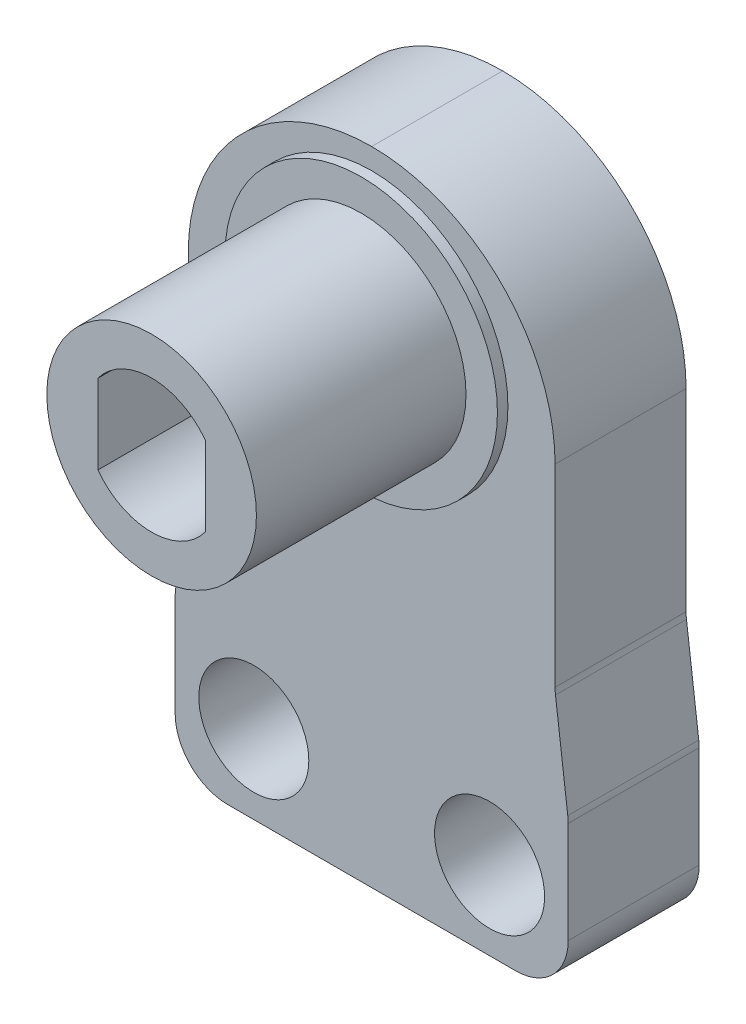
from build123d import *

# Parameters (mm, degrees)
SKETCH2_W           = 71.4
SKETCH2_H           = 93
SKETCH2_W_2         = 51.4
SKETCH2_H_2         = 73
BOSS_EXTRUDE1_DEPTH = 10
SKETCH3_W           = 14
SKETCH3_H           = 26
SKETCH3_R           = 2.75
BOSS_EXTRUDE2_DEPTH = 5
SKETCH4_R           = 4
SKETCH4_R_2         = 2.75
BOSS_EXTRUDE3_DEPTH = 8.4
SKETCH5_W           = 51.4
SKETCH5_H           = 10
CUT_EXTRUDE1_DEPTH  = 65.130647899
SKETCH6_R           = 5.2
SKETCH6_R_2         = 4
BOSS_EXTRUDE4_DEPTH = 0.4
SKETCH7_W           = 71.4
SKETCH7_H           = 25
CUT_EXTRUDE2_DEPTH  = 65.130647899
FILLET1_START       = -46.5
FILLET1_DEPTH       = 5
FILLET1_2_DEPTH     = 5
SKETCH10_W          = 71.4
SKETCH10_H          = 58
CUT_EXTRUDE3_DEPTH  = 65.130647899
SKETCH9_R           = 2.55
CUT_EXTRUDE4_DEPTH  = 53.440919138
FILLET2_R           = 5
SKETCH11_R          = 2.75
BOSS_EXTRUDE5_DEPTH = 13.4
CHAMFER1_SIZE       = 0.5
CUT_EXTRUDE5_DEPTH  = 52.676783956
SKETCH14_R          = 2.1
BOSS_EXTRUDE6_DEPTH = 5
FILLET3_R           = 2


with BuildPart() as part:
    # Sketch2 → Boss-Extrude1 (new body)
    with BuildSketch(Plane(origin=(0, 0, 0), x_dir=(1, 0, 0), z_dir=(0, 1, 0))):
        Rectangle(SKETCH2_W, SKETCH2_H)
        Rectangle(SKETCH2_W_2, SKETCH2_H_2, mode=Mode.SUBTRACT)
    extrude(amount=BOSS_EXTRUDE1_DEPTH)

    # Sketch3 → Boss-Extrude2 (add)
    with BuildSketch(Plane(origin=(0, 0, -46.5), x_dir=(-1, 0, 0), z_dir=(0, 0, -1))):
        with Locations((0, 23)):
            Rectangle(SKETCH3_W, SKETCH3_H)
        with Locations((0, 30)):
            Circle(SKETCH3_R, mode=Mode.SUBTRACT)
    extrude(amount=-BOSS_EXTRUDE2_DEPTH)

    # Sketch4 → Boss-Extrude3 (add)
    with BuildSketch(Plane.XY.offset(-41.5)):
        with Locations(Location((0, 30, 0), (0, 0, 180))):
            Circle(SKETCH4_R)
        with Locations(Location((0, 30, 0), (0, 0, 180))):
            Circle(SKETCH4_R_2, mode=Mode.SUBTRACT)
    extrude(amount=BOSS_EXTRUDE3_DEPTH)

    # Sketch5 → Cut-Extrude1 (cut, through all)
    with BuildSketch(Plane(origin=(0, 10, 0), x_dir=(1, 0, 0), z_dir=(0, 1, 0))):
        with Locations((0, -41.5)):
            Rectangle(SKETCH5_W, SKETCH5_H)
    extrude(amount=-CUT_EXTRUDE1_DEPTH, mode=Mode.SUBTRACT)

    # Sketch6 → Boss-Extrude4 (add)
    with BuildSketch(Plane.XY.offset(-41.5)):
        with Locations(Location((0, 30, 0), (0, 0, 180))):
            Circle(SKETCH6_R)
        with Locations((0, 30)):
            Circle(SKETCH6_R_2, mode=Mode.SUBTRACT)
    extrude(amount=BOSS_EXTRUDE4_DEPTH)

    # Sketch7 → Cut-Extrude2 (cut, through all)
    with BuildSketch(Plane(origin=(0, 10, 0), x_dir=(1, 0, 0), z_dir=(0, 1, 0))):
        with Locations((0, -34)):
            Rectangle(SKETCH7_W, SKETCH7_H)
    extrude(amount=-CUT_EXTRUDE2_DEPTH, mode=Mode.SUBTRACT)

    # Fillet1: read off the stored shape, not the designer's step
    # Fillet1 outline → Fillet1 (cut)
    with BuildSketch(Plane.XY.offset(FILLET1_START)):
        with BuildLine():
            ThreePointArc((0, 36), (4.949747468, 33.949747468), (7, 29))
            Line((7, 29), (7, 36))
            Line((7, 36), (0, 36))
        make_face()
        with BuildLine():
            ThreePointArc((-7, 29), (-4.949747468, 33.949747468), (0, 36))
            Line((0, 36), (-7, 36))
            Line((-7, 36), (-7, 29))
        make_face()
    extrude(amount=FILLET1_DEPTH, mode=Mode.SUBTRACT)

    # Fillet1 2 outline → Fillet1 2 (add)
    with BuildSketch(Plane.XY.offset(FILLET1_START)):
        with BuildLine():
            ThreePointArc((14, 10), (9.050252532, 12.050252532), (7, 17))
            Line((7, 17), (7, 10))
            Line((7, 10), (14, 10))
        make_face()
        with BuildLine():
            Line((-14, 10), (-7, 10))
            Line((-7, 10), (-7, 17))
            ThreePointArc((-7, 17), (-9.050252532, 12.050252532), (-14, 10))
        make_face()
    extrude(amount=FILLET1_2_DEPTH)

    # Sketch10 → Cut-Extrude3 (cut, through all)
    with BuildSketch(Plane(origin=(0, 10, 0), x_dir=(1, 0, 0), z_dir=(0, 1, 0))):
        with Locations((0, 7.5)):
            Rectangle(SKETCH10_W, SKETCH10_H)
    extrude(amount=-CUT_EXTRUDE3_DEPTH, mode=Mode.SUBTRACT)

    # Sketch9 → Cut-Extrude4 (cut, through all)
    with BuildSketch(Plane(origin=(0, 0, -46.5), x_dir=(-1, 0, 0), z_dir=(0, 0, -1))):
        with Locations((-28.2, 5)):
            Circle(SKETCH9_R)
        with Locations((28.2, 5)):
            Circle(SKETCH9_R)
    extrude(amount=-CUT_EXTRUDE4_DEPTH, mode=Mode.SUBTRACT)

    # Fillet2
    fillet2_edges = [part.edges().sort_by_distance(p)[0] for p in [
        (-35.7, 10, -41.5),
        (-35.7, 0, -41.5),
        (35.7, 0, -41.5),
        (35.7, 10, -41.5),
    ]]
    fillet(fillet2_edges, radius=FILLET2_R - 0.0001)  # a hair under: the kernel refuses the full size

    # Sketch11 → Boss-Extrude5 (add)
    with BuildSketch(Plane(origin=(0, 0, -46.5), x_dir=(-1, 0, 0), z_dir=(0, 0, -1))):
        with Locations((0, 30)):
            Circle(SKETCH11_R)
        with BuildLine():
            Line((-2.05, 31.516575089), (-2.05, 28.483424911))
            ThreePointArc((-2.05, 28.483424911), (0, 27.45), (2.05, 28.483424911))
            Line((2.05, 28.483424911), (2.05, 31.516575089))
            ThreePointArc((2.05, 31.516575089), (0, 32.55), (-2.05, 31.516575089))
        make_face(mode=Mode.SUBTRACT)
    extrude(amount=-BOSS_EXTRUDE5_DEPTH)

    # Chamfer1
    chamfer1_edges = [part.edges().sort_by_distance(p)[0] for p in [
        (0, 32.55, -46.5),
        (-2.05, 30, -46.5),
        (0, 27.45, -46.5),
        (2.05, 30, -46.5),
    ]]
    chamfer(chamfer1_edges, length=CHAMFER1_SIZE)

    # Sketch12 → Cut-Extrude5 (cut, through all)
    with BuildSketch(Plane.XY.offset(-36.5)):
        with BuildLine():
            Line((-7, 17), (7, 17))
            ThreePointArc((7, 17), (9.050252532, 12.050252532), (14, 10))
            Line((14, 10), (30.7, 10))
            ThreePointArc((30.7, 10), (34.235533906, 8.535533906), (35.7, 5))
            ThreePointArc((35.7, 5), (34.235533906, 1.464466094), (30.7, 0))
            Line((30.7, 0), (-30.7, 0))
            ThreePointArc((-30.7, 0), (-34.235533906, 1.464466094), (-35.7, 5))
            ThreePointArc((-35.7, 5), (-34.235533906, 8.535533906), (-30.7, 10))
            Line((-30.7, 10), (-14, 10))
            ThreePointArc((-14, 10), (-9.050252532, 12.050252532), (-7, 17))
        make_face()
    extrude(amount=-CUT_EXTRUDE5_DEPTH, mode=Mode.SUBTRACT)


with BuildPart() as cut_extrude5_kept_piece:
    # of the separate pieces the step leaves, the one the design keeps (cut_extrude5_pieces_kept)
    add(part.part.solids().sort_by_distance((7, 17, -46.5))[0])

    # Sketch14 → Boss-Extrude6 (add)
    with BuildSketch(Plane.XY.offset(-41.5)):
        Polygon((-7, 21.5), (-7.5, 17.5), (-7.5, 11.5), (7.5, 11.5), (7.5, 17.5), (7, 21.5), (7, 17), (-7, 17), align=None)
        with Locations((-4.5, 14.5)):
            Circle(SKETCH14_R, mode=Mode.SUBTRACT)
        with Locations((4.5, 14.5)):
            Circle(SKETCH14_R, mode=Mode.SUBTRACT)
    extrude(amount=-BOSS_EXTRUDE6_DEPTH)

    # Fillet3
    fillet3_edges = [cut_extrude5_kept_piece.edges().sort_by_distance(p)[0] for p in [
        (-7.5, 17.5, -44),
        (-7.5, 11.5, -44),
        (7.5, 11.5, -44),
        (7.5, 17.5, -44),
        (7, 21.5, -44),
        (-7, 21.5, -44),
    ]]
    fillet(fillet3_edges, radius=FILLET3_R)


solid = cut_extrude5_kept_piece.part
